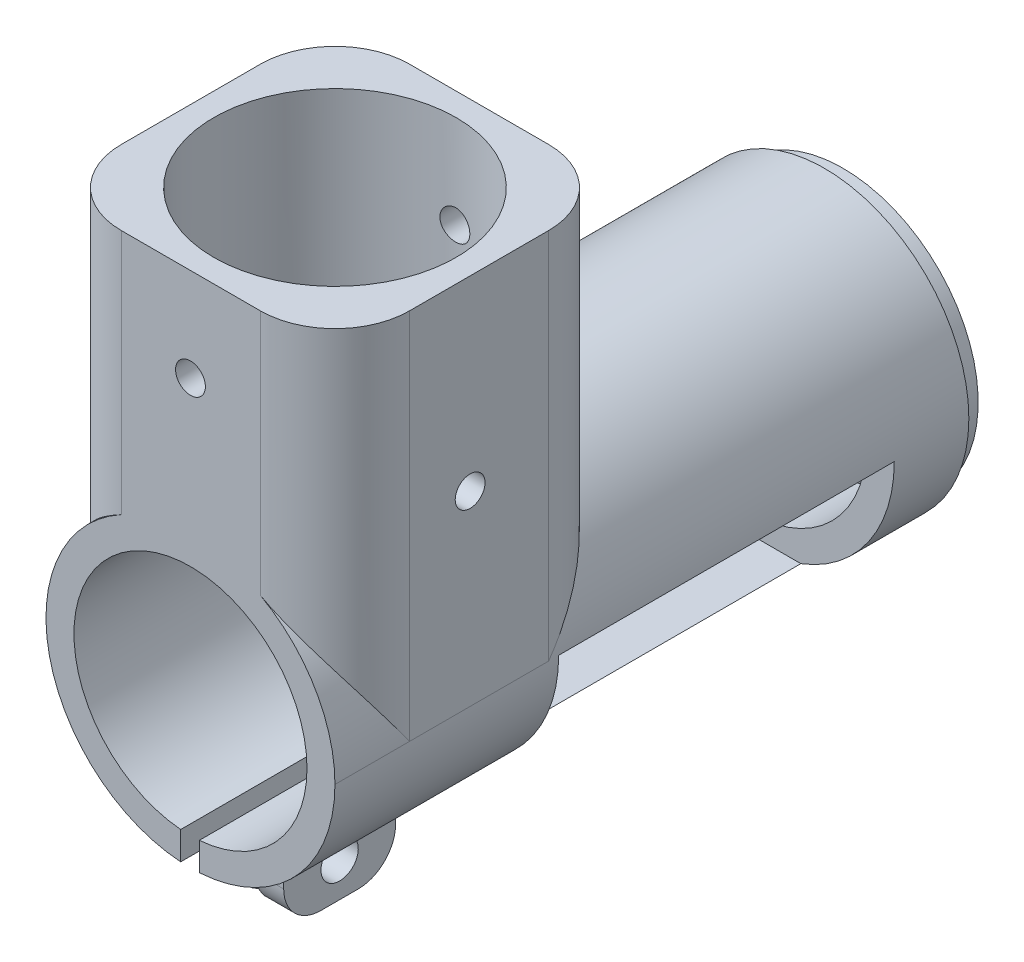
from build123d import *

# Parameters (mm, degrees)
SKETCH_1_R               = 15.5
SKETCH_1_R_2             = 12.5
EXTRUDE_1_DEPTH          = 68
SKETCH_2_R               = 14.5
SKETCH_2_R_2             = 1.6
SKETCH_2_R_3             = 5
EXTRUDE_2_DEPTH          = 2
SKETCH_3_R               = 13
EXTRUDE_3_DEPTH          = 40
CUT_EXTRUDE_START        = -40
SKETCH_4_R               = 12.5
CUT_EXTRUDE_1_DEPTH      = 40
SKETCH_5_R               = 1.6
CUT_EXTRUDE_4_DEPTH      = 81.400559864
CUT_EXTRUDE_5_DEPTH      = 40
CUT_EXTRUDE_5_DEPTH_BACK = 40
SKETCH_6_R               = 1.6
CUT_EXTRUDE_6_DEPTH      = 81.400559864
CUT_EXTRUDE_6_DEPTH_BACK = 81.400559864
SKETCH_7_W               = 36
SKETCH_7_H               = 14.5
SKETCH_8_W               = 2
SKETCH_8_H               = 10.589049083
CUT_EXTRUDE_7_DEPTH      = 40
EXTRUDE_4_DEPTH          = 6
EXTRUDE_4_DEPTH_BACK     = 6
SKETCH_9_W               = 3.9529011
SKETCH_9_H               = 10.003869646
SKETCH_9_W_2             = 3.0470989
SKETCH_9_H_2             = 9.996309536
SKETCH_10_R              = 2
CUT_EXTRUDE_8_DEPTH      = 82.266536936
CUT_EXTRUDE_9_DEPTH      = 2
FILLET_1_R               = 4


with BuildPart() as part:
    # Эскиз1 → Бобышка-Вытянуть1 (new body)
    with BuildSketch(Plane.XY):
        Circle(SKETCH_1_R)
        Circle(SKETCH_1_R_2, mode=Mode.SUBTRACT)
    extrude(amount=EXTRUDE_1_DEPTH)

    # Эскиз2 → Бобышка-Вытянуть2 (add)
    with BuildSketch(Plane(origin=(0, 0, 0), x_dir=(-1, 0, 0), z_dir=(0, 0, -1))):
        Circle(SKETCH_2_R)
        with Locations((8.5, 0)):
            Circle(SKETCH_2_R_2, mode=Mode.SUBTRACT)
        with Locations((-8.5, 0)):
            Circle(SKETCH_2_R_2, mode=Mode.SUBTRACT)
        Circle(SKETCH_2_R_3, mode=Mode.SUBTRACT)
    extrude(amount=EXTRUDE_2_DEPTH)

    # Эскиз3 → Бобышка-Вытянуть3 (add)
    with BuildSketch(Plane(origin=(0, 0, 0), x_dir=(1, 0, 0), z_dir=(0, 1, 0))):
        with BuildLine():
            Line((-7.417425678, -37.082574322), (7.5, -37.082574322))
            ThreePointArc((7.5, -37.082574322), (13.156854249, -39.425720072), (15.5, -45.082574322))
            Line((15.5, -45.082574322), (15.5, -60))
            ThreePointArc((15.5, -60), (13.156854249, -65.656854249), (7.5, -68))
            Line((7.5, -68), (-7.417425678, -68))
            ThreePointArc((-7.417425678, -68), (-13.074279928, -65.656854249), (-15.417425678, -60))
            Line((-15.417425678, -60), (-15.417425678, -45.082574322))
            ThreePointArc((-15.417425678, -45.082574322), (-13.074279928, -39.425720072), (-7.417425678, -37.082574322))
        make_face()
        with Locations((0.041287161, -52.541287161)):
            Circle(SKETCH_3_R, mode=Mode.SUBTRACT)
    extrude(amount=EXTRUDE_3_DEPTH)

    # Эскиз4 → Вырез-Вытянуть1 (cut)
    with BuildSketch(Plane.XY.offset(68).offset(CUT_EXTRUDE_START)):
        Circle(SKETCH_4_R)
    extrude(amount=CUT_EXTRUDE_1_DEPTH, mode=Mode.SUBTRACT)

    # Эскиз5 → Вырез-Вытянуть4 (cut, through all)
    with BuildSketch(Plane.XY):
        with Locations((0, 30)):
            Circle(SKETCH_5_R)
    extrude(amount=CUT_EXTRUDE_4_DEPTH, mode=Mode.SUBTRACT)

    # Эскиз6 → Вырез-Вытянуть5 (cut, two sides: drawn at the far end of the back side and taken through both)
    with BuildSketch(Plane(origin=(0, 0, 0), x_dir=(0, 0, -1), z_dir=(1, 0, 0)).offset(-CUT_EXTRUDE_5_DEPTH_BACK)):
        with Locations((-53.5, 20)):
            Circle(SKETCH_6_R)
    extrude(amount=CUT_EXTRUDE_5_DEPTH + CUT_EXTRUDE_5_DEPTH_BACK, mode=Mode.SUBTRACT)

    # Эскиз7 → Вырез-Вытянуть6 (cut, two sides: drawn at the far end of the back side and taken through both)
    with BuildSketch(Plane(origin=(0, 0, 0), x_dir=(0, 0, -1), z_dir=(1, 0, 0)).offset(-CUT_EXTRUDE_6_DEPTH_BACK)):
        with Locations((-26, -7.25)):
            Rectangle(SKETCH_7_W, SKETCH_7_H)
    extrude(amount=CUT_EXTRUDE_6_DEPTH + CUT_EXTRUDE_6_DEPTH_BACK, mode=Mode.SUBTRACT)

    # Эскиз8 → Вырез-Вытянуть7 (cut)
    with BuildSketch(Plane.XY.offset(68)):
        with Locations((-0.0470989, -15.499928442)):
            Rectangle(SKETCH_8_W, SKETCH_8_H)
    extrude(amount=-CUT_EXTRUDE_7_DEPTH, mode=Mode.SUBTRACT)

    # Эскиз9 → Бобышка-Вытянуть4 (add, two sides: drawn at the far end of the back side and taken through both)
    with BuildSketch(Plane(origin=(0, 0, 56), x_dir=(-1, 0, 0), z_dir=(0, 0, -1)).offset(-EXTRUDE_4_DEPTH_BACK)):
        with Locations((3.02354945, -17.458000971)):
            Rectangle(SKETCH_9_W, SKETCH_9_H)
        with Locations((-2.47645055, -17.461781026)):
            Rectangle(SKETCH_9_W_2, SKETCH_9_H_2)
    extrude(amount=EXTRUDE_4_DEPTH + EXTRUDE_4_DEPTH_BACK)

    # Эскиз10 → Вырез-Вытянуть8 (cut, through all)
    with BuildSketch(Plane(origin=(4, 0, 0), x_dir=(0, 0, -1), z_dir=(1, 0, 0))):
        with Locations((-56, -18.717457463)):
            Circle(SKETCH_10_R)
    extrude(amount=-CUT_EXTRUDE_8_DEPTH, mode=Mode.SUBTRACT)

    # Эскиз11 → Вырез-Вытянуть9 (cut)
    with BuildSketch(Plane.ZY.offset(5)):
        Polygon((60.041451884, -18.717457463), (58.020725942, -15.217457463), (53.979274058, -15.217457463), (51.958548116, -18.717457463), (53.979274058, -22.217457463), (58.020725942, -22.217457463), align=None)
    extrude(amount=-CUT_EXTRUDE_9_DEPTH, mode=Mode.SUBTRACT)

    # Скругление1
    fillet_1_edges = [part.edges().sort_by_distance(p)[0] for p in [
        (-3.02354945, -22.459935794, 50),
        (-3.02354945, -22.459935794, 62),
        (2.47645055, -22.459935794, 62),
        (2.47645055, -22.459935794, 50),
    ]]
    fillet(fillet_1_edges, radius=FILLET_1_R)


solid = part.part
